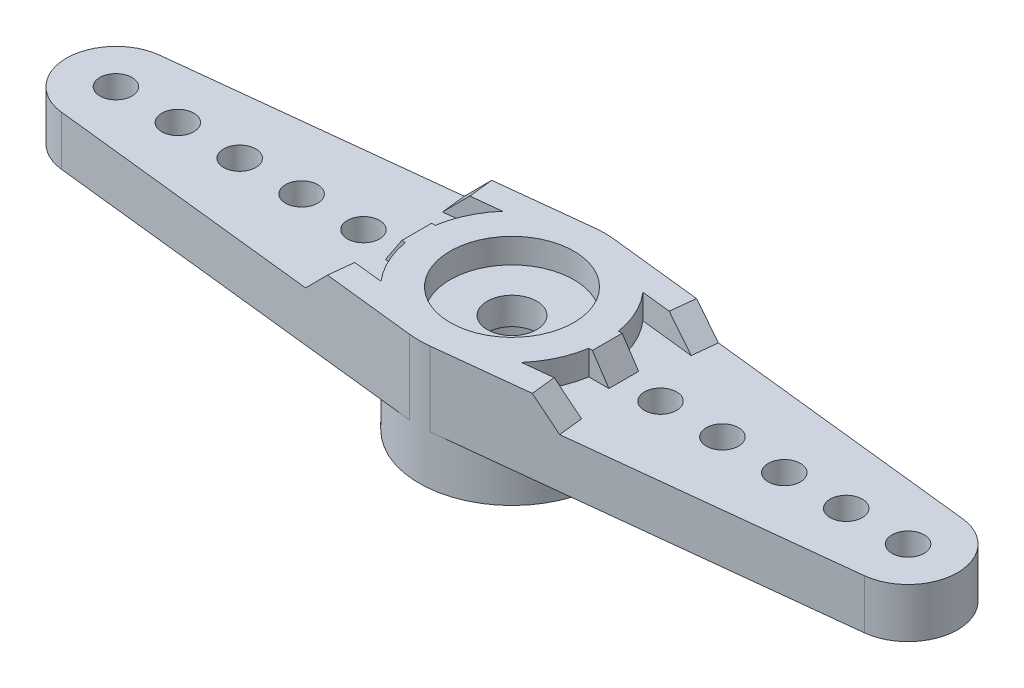
from build123d import *
from OCP.BRepFilletAPI import BRepFilletAPI_MakeChamfer
from build123d.topology import SkipClean

# Parameters (mm, degrees)
SKETCH_1_R            = 0.65
SKETCH_1_R_2          = 1
EXTRUDE_1_DEPTH       = 2
EXTRUDE_START         = 1.5
SKETCH_2_R            = 3.75
SKETCH_2_R_2          = 1
EXTRUDE_2_DEPTH       = 1.5
SKETCH_3_R            = 3.75
SKETCH_3_R_2          = 1
EXTRUDE_3_DEPTH       = 1.5
EXTRUDE_4_DEPTH       = 1
SKETCH_5_R            = 2.5
CUT_EXTRUDE_1_DEPTH   = 2.5
CUT_EXTRUDE_START     = -1.5
SKETCH_6_R            = 2.5
CUT_EXTRUDE_2_DEPTH   = 1.5
MIRROR_2_COPY_1_DEPTH = 1
SKETCH_7_W            = 2.19635709
SKETCH_7_H            = 1.2
EXTRUDE_5_DEPTH       = 1.5
CHAMFER_1_SIZE        = 1.5
CHAMFER_1_SIZE_2      = 1
SKETCH_8_R            = 1
SKETCH_8_R_2          = 0.65
EXTRUDE_6_DEPTH       = 0.5
CUT_EXTRUDE_3_DEPTH   = 0.5
SKETCH_10_R           = 2.5
CUT_EXTRUDE_4_DEPTH   = 1.4
SKETCH_11_R           = 2.65
CUT_EXTRUDE_5_DEPTH   = 2.9


with BuildPart() as part:
    # 草图1 → 凸台-拉伸1 (new body)
    with BuildSketch(Plane(origin=(0, 0, 0), x_dir=(1, 0, 0), z_dir=(0, 1, 0))):
        with BuildLine():
            Line((0.41015625, 3.727502093), (16.21875, 1.988001116))
            ThreePointArc((16.21875, 1.988001116), (18, 0), (16.21875, -1.988001116))
            Line((16.21875, -1.988001116), (0.41015625, -3.727502093))
            ThreePointArc((0.41015625, -3.727502093), (-3.75, 0), (0.41015625, 3.727502093))
        make_face()
        with Locations(Location((16, 0, 0), (0, 0, 270))):
            Circle(SKETCH_1_R, mode=Mode.SUBTRACT)
        with Locations(Location((6, 0, 0), (0, 0, 270))):
            Circle(SKETCH_1_R, mode=Mode.SUBTRACT)
        with Locations(Location((8.5, 0, 0), (0, 0, 270))):
            Circle(SKETCH_1_R, mode=Mode.SUBTRACT)
        with Locations(Location((11, 0, 0), (0, 0, 270))):
            Circle(SKETCH_1_R, mode=Mode.SUBTRACT)
        with Locations(Location((13.5, 0, 0), (0, 0, 270))):
            Circle(SKETCH_1_R, mode=Mode.SUBTRACT)
        with Locations(Location((0, 0, 0), (0, 0, 270))):
            Circle(SKETCH_1_R_2, mode=Mode.SUBTRACT)
    extrude_1 = extrude(amount=EXTRUDE_1_DEPTH)

    # 草图2 → 凸台-拉伸2 (add)
    with SkipClean():  # the faces are left unmerged after this step: merging them gives an invalid solid
        with BuildSketch(Plane.XZ.offset(EXTRUDE_START)):
            with Locations(Location((0, 0, 0), (0, 0, 270))):
                Circle(SKETCH_2_R)
            with Locations(Location((0, 0, 0), (0, 0, 270))):
                Circle(SKETCH_2_R_2, mode=Mode.SUBTRACT)
        extrude(amount=-EXTRUDE_2_DEPTH)

    # 草图3 → 凸台-拉伸3 (add)
    with SkipClean():  # the faces are left unmerged after this step: merging them gives an invalid solid
        with BuildSketch(Plane(origin=(0, 2, 0), x_dir=(1, 0, 0), z_dir=(0, 1, 0))):
            with Locations(Location((0, 0, 0), (0, 0, 90))):
                Circle(SKETCH_3_R)
            with Locations(Location((0, 0, 0), (0, 0, 90))):
                Circle(SKETCH_3_R_2, mode=Mode.SUBTRACT)
        extrude(amount=EXTRUDE_3_DEPTH)

    # 草图4 → 凸台-拉伸4 (add)
    with SkipClean():  # the faces are left unmerged after this step: merging them gives an invalid solid
        with BuildSketch(Plane(origin=(0.41015625, 0, 3.727502093), x_dir=(0.9940005580355578, 0, -0.10937499999999994), z_dir=(0.10937499999999994, 0, 0.9940005580355578))):
            Polygon((0, 2), (0, 3.5), (3.75, 3.5), (5.25, 2), align=None)
        extrude_4 = extrude(amount=-EXTRUDE_4_DEPTH)

    # 镜向1: 凸台-拉伸4 across plane
    with SkipClean():  # the faces are left unmerged after this step: merging them gives an invalid solid
        add(extrude_4.mirror(Plane.XY))

    # 草图5 → 切除-拉伸1 (cut)
    with SkipClean():  # the faces are left unmerged after this step: merging them gives an invalid solid
        with BuildSketch(Plane.XZ.offset(1.5)):
            with Locations(Location((0, 0, 0), (0, 0, 270))):
                Circle(SKETCH_5_R)
        extrude(amount=-CUT_EXTRUDE_1_DEPTH, mode=Mode.SUBTRACT)

    # 草图6 → 切除-拉伸2 (cut)
    with SkipClean():  # the faces are left unmerged after this step: merging them gives an invalid solid
        with BuildSketch(Plane(origin=(0, 3.5, 0), x_dir=(1, 0, 0), z_dir=(0, 1, 0)).offset(CUT_EXTRUDE_START)):
            with Locations(Location((0, 0, 0), (0, 0, 90))):
                Circle(SKETCH_6_R)
        extrude(amount=CUT_EXTRUDE_2_DEPTH, mode=Mode.SUBTRACT)

    # 镜向2: 凸台-拉伸1, 凸台-拉伸4 across plane
    with SkipClean():  # the faces are left unmerged after this step: merging them gives an invalid solid
        add(extrude_1.mirror(Plane(origin=(0, 0, 0), x_dir=(0, 0, 1), z_dir=(1, 0, 0))))
        add(extrude_4.mirror(Plane(origin=(0, 0, 0), x_dir=(0, 0, 1), z_dir=(1, 0, 0))))

    # 镜向2 copy 1 sketch → 镜向2 copy 1 (add)
    with SkipClean():  # the faces are left unmerged after this step: merging them gives an invalid solid
        with BuildSketch(Plane(origin=(-0.41015625, 0, -3.727502093), x_dir=(-0.9940005580355578, 0, 0.10937499999999994), z_dir=(-0.10937499999999994, 0, -0.9940005580355578))):
            Polygon((0, 2), (0, 3.5), (3.75, 3.5), (5.25, 2), align=None)
        extrude(amount=-MIRROR_2_COPY_1_DEPTH)

    # 草图7 → 凸台-拉伸5 (add)
    with SkipClean():  # the faces are left unmerged after this step: merging them gives an invalid solid
        with BuildSketch(Plane(origin=(0, 3.5, 0), x_dir=(1, 0, 0), z_dir=(0, 1, 0))):
            with Locations((3.75, 0)):
                Rectangle(SKETCH_7_W, SKETCH_7_H)
            with Locations((-3.75, 0)):
                Rectangle(SKETCH_7_W, SKETCH_7_H)
        extrude(amount=-EXTRUDE_5_DEPTH)

    # 倒角1
    chamfer_1_edges_1 = [part.edges().sort_by_distance(p)[0] for p in [
        (4.848178545, 3.5, 0),
    ]]
    chamfer_1_side_1 = [part.faces().sort_by_distance(p)[0] for p in [
        (4.848178545, 3.48, 0),
    ]]
    chamfer_1_edges_2 = [part.edges().sort_by_distance(p)[0] for p in [
        (-4.848178545, 3.5, 0),
    ]]
    chamfer_1_side_2 = [part.faces().sort_by_distance(p)[0] for p in [
        (-4.848178545, 3.48, 0),
    ]]
    chamfer_1 = BRepFilletAPI_MakeChamfer(part.part.solid().wrapped)
    for e in chamfer_1_edges_1:
        chamfer_1.Add(CHAMFER_1_SIZE - 0.0001, CHAMFER_1_SIZE_2 - 0.0001, e.wrapped, chamfer_1_side_1[0].wrapped)
    for e in chamfer_1_edges_2:
        chamfer_1.Add(CHAMFER_1_SIZE - 0.0001, CHAMFER_1_SIZE_2 - 0.0001, e.wrapped, chamfer_1_side_2[0].wrapped)
    add(Compound.cast(chamfer_1.Shape()), mode=Mode.REPLACE)  # a hair under: the kernel refuses the full size

    # 草图8 → 凸台-拉伸6 (add)
    with BuildSketch(Plane(origin=(0, 2, 0), x_dir=(1, 0, 0), z_dir=(0, 1, 0))):
        with BuildLine():
            Line((-5.62865918, -3.153283343), (-16.21875, -1.988001116))
            ThreePointArc((-16.21875, -1.988001116), (-18, 0), (-16.21875, 1.988001116))
            Line((-16.21875, 1.988001116), (-5.62865918, 3.153283343))
            Line((-5.62865918, 3.153283343), (-4.137658343, 3.317345843))
            Line((-4.137658343, 3.317345843), (-0.41015625, 3.727502093))
            ThreePointArc((-0.41015625, 3.727502093), (0, 3.75), (0.41015625, 3.727502093))
            Line((0.41015625, 3.727502093), (4.137658343, 3.317345843))
            Line((4.137658343, 3.317345843), (5.62865918, 3.153283343))
            Line((5.62865918, 3.153283343), (16.21875, 1.988001116))
            ThreePointArc((16.21875, 1.988001116), (18, 0), (16.21875, -1.988001116))
            Line((16.21875, -1.988001116), (5.62865918, -3.153283343))
            Line((5.62865918, -3.153283343), (4.137658343, -3.317345843))
            Line((4.137658343, -3.317345843), (0.41015625, -3.727502093))
            ThreePointArc((0.41015625, -3.727502093), (0, -3.75), (-0.41015625, -3.727502093))
            Line((-0.41015625, -3.727502093), (-4.137658343, -3.317345843))
            Line((-4.137658343, -3.317345843), (-5.62865918, -3.153283343))
        make_face()
        with Locations(Location((0, 0, 0), (0, 0, 270))):
            Circle(SKETCH_8_R, mode=Mode.SUBTRACT)
        with Locations(Location((16, 0, 0), (0, 0, 270))):
            Circle(SKETCH_8_R_2, mode=Mode.SUBTRACT)
        with Locations(Location((13.5, 0, 0), (0, 0, 270))):
            Circle(SKETCH_8_R_2, mode=Mode.SUBTRACT)
        with Locations(Location((11, 0, 0), (0, 0, 270))):
            Circle(SKETCH_8_R_2, mode=Mode.SUBTRACT)
        with Locations(Location((8.5, 0, 0), (0, 0, 270))):
            Circle(SKETCH_8_R_2, mode=Mode.SUBTRACT)
        with Locations(Location((6, 0, 0), (0, 0, 270))):
            Circle(SKETCH_8_R_2, mode=Mode.SUBTRACT)
        with Locations(Location((-6, 0, 0), (0, 0, 270))):
            Circle(SKETCH_8_R_2, mode=Mode.SUBTRACT)
        with Locations(Location((-8.5, 0, 0), (0, 0, 270))):
            Circle(SKETCH_8_R_2, mode=Mode.SUBTRACT)
        with Locations(Location((-11, 0, 0), (0, 0, 270))):
            Circle(SKETCH_8_R_2, mode=Mode.SUBTRACT)
        with Locations(Location((-13.5, 0, 0), (0, 0, 270))):
            Circle(SKETCH_8_R_2, mode=Mode.SUBTRACT)
        with Locations(Location((-16, 0, 0), (0, 0, 270))):
            Circle(SKETCH_8_R_2, mode=Mode.SUBTRACT)
    extrude(amount=EXTRUDE_6_DEPTH)

    # 草图9 → 切除-拉伸3 (cut)
    with BuildSketch(Plane.XZ):
        with BuildLine():
            Line((0.41015625, -3.727502093), (16.21875, -1.988001116))
            ThreePointArc((16.21875, -1.988001116), (18, 0), (16.21875, 1.988001116))
            Line((16.21875, 1.988001116), (0.41015625, 3.727502093))
            ThreePointArc((0.41015625, 3.727502093), (3.75, 0), (0.41015625, -3.727502093))
        make_face()
        with BuildLine():
            Line((-16.21875, -1.988001116), (-0.41015625, -3.727502093))
            ThreePointArc((-0.41015625, -3.727502093), (-3.75, 0), (-0.41015625, 3.727502093))
            Line((-0.41015625, 3.727502093), (-16.21875, 1.988001116))
            ThreePointArc((-16.21875, 1.988001116), (-18, 0), (-16.21875, -1.988001116))
        make_face()
    extrude(amount=-CUT_EXTRUDE_3_DEPTH, mode=Mode.SUBTRACT)

    # 草图10 → 切除-拉伸4 (cut)
    with BuildSketch(Plane.XZ):
        with Locations(Location((0, 0, 0), (0, 0, 270))):
            Circle(SKETCH_10_R)
    extrude(amount=-CUT_EXTRUDE_4_DEPTH, mode=Mode.SUBTRACT)

    # 草图11 → 切除-拉伸5 (cut)
    with BuildSketch(Plane.XZ.offset(1.5)):
        with Locations(Location((0, 0, 0), (0, 0, 270))):
            Circle(SKETCH_11_R)
    extrude(amount=-CUT_EXTRUDE_5_DEPTH, mode=Mode.SUBTRACT)


solid = part.part
